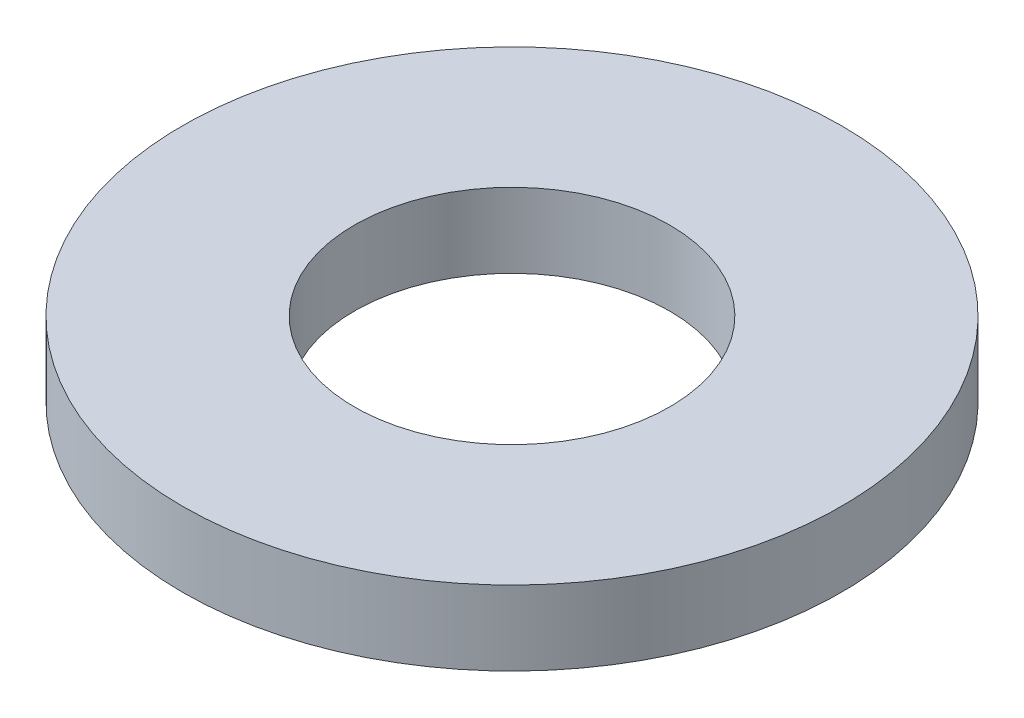
from build123d import *

# Parameters (mm, degrees)
SKETCH1_R           = 57.5
BOSS_EXTRUDE1_DEPTH = 13
SKETCH2_R           = 27.5
CUT_EXTRUDE1_DEPTH  = 83.349863388


with BuildPart() as part:
    # Sketch1 → Boss-Extrude1 (new body)
    with BuildSketch(Plane(origin=(0, 0, 0), x_dir=(1, 0, 0), z_dir=(0, 1, 0))):
        Circle(SKETCH1_R)
    extrude(amount=BOSS_EXTRUDE1_DEPTH)

    # Sketch2 → Cut-Extrude1 (cut, through all)
    with BuildSketch(Plane(origin=(0, 0, 0), x_dir=(1, 0, 0), z_dir=(0, 1, 0))):
        Circle(SKETCH2_R)
    extrude(amount=CUT_EXTRUDE1_DEPTH, mode=Mode.SUBTRACT)


solid = part.part
